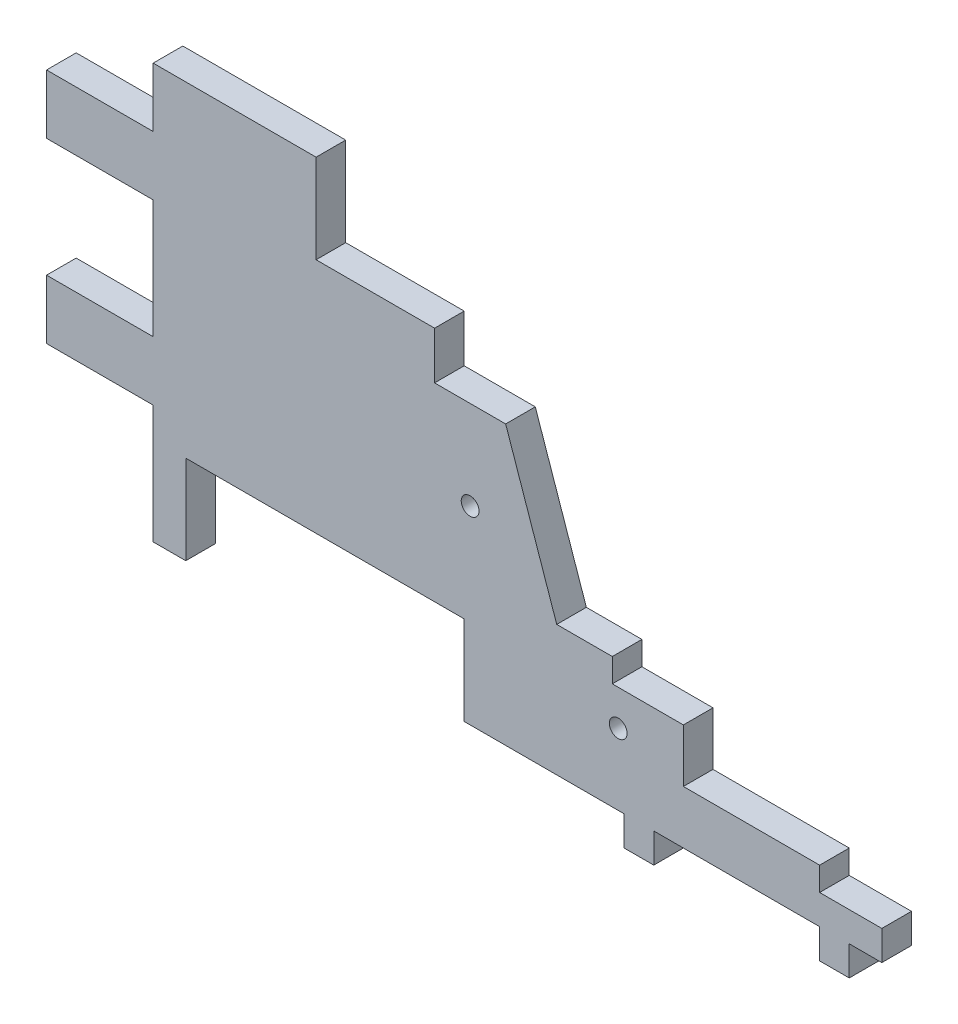
from build123d import *

# Parameters (mm, degrees)
ESQUISSE1_R             = 1.5
BOSS_EXTRU_1_DEPTH      = 5
BOSS_EXTRU_2_DEPTH      = 5
ESQUISSE4_W             = 5
ESQUISSE4_H             = 15
ENL_V_MAT_EXTRU_1_DEPTH = 10


with BuildPart() as part:
    # Esquisse1 → Boss.-Extru.1 (new body)
    with BuildSketch(Plane.XY):
        Polygon((0, 0), (32, 0), (32, -5), (37, -5), (37, 0), (37, 18), (22, 18), (12, 47), (0, 47), align=None)
        with Locations((6, 32)):
            Circle(ESQUISSE1_R, mode=Mode.SUBTRACT)
        with Locations((31, 12)):
            Circle(ESQUISSE1_R, mode=Mode.SUBTRACT)
    extrude(amount=BOSS_EXTRU_1_DEPTH)

    # Esquisse2 → Boss.-Extru.2 (add)
    with BuildSketch(Plane(origin=(0, 0, 0), x_dir=(-1, 0, 0), z_dir=(0, 0, -1))):
        Polygon((-37, 0), (-65, 0), (-65, -5), (-70, -5), (-70, 0), (-75.5, 0), (-75.5, 5), (-65, 5), (-65, 9), (-42, 9), (-42, 18), (-37, 18), align=None)
        Polygon((42, 0), (47.5, 0), (47.5, 20), (65.5, 20), (65.5, 30), (47.5, 30), (47.5, 50), (65.5, 50), (65.5, 60), (47.5, 60), (47.5, 70), (20, 70), (20, 55), (0, 55), (0, 15), (42, 15), align=None)
        Polygon((-30, 18), (-22, 18), (-20.620689655, 22), (-30, 22), align=None)
    extrude(amount=-BOSS_EXTRU_2_DEPTH)

    # Esquisse4 → Enlèv. mat.-Extru.1 (cut)
    with BuildSketch(Plane(origin=(0, 0, 0), x_dir=(-1, 0, 0), z_dir=(0, 0, -1))):
        with Locations((-2.5, 7.5)):
            Rectangle(ESQUISSE4_W, ESQUISSE4_H)
    extrude(amount=-ENL_V_MAT_EXTRU_1_DEPTH, mode=Mode.SUBTRACT)


solid = part.part
